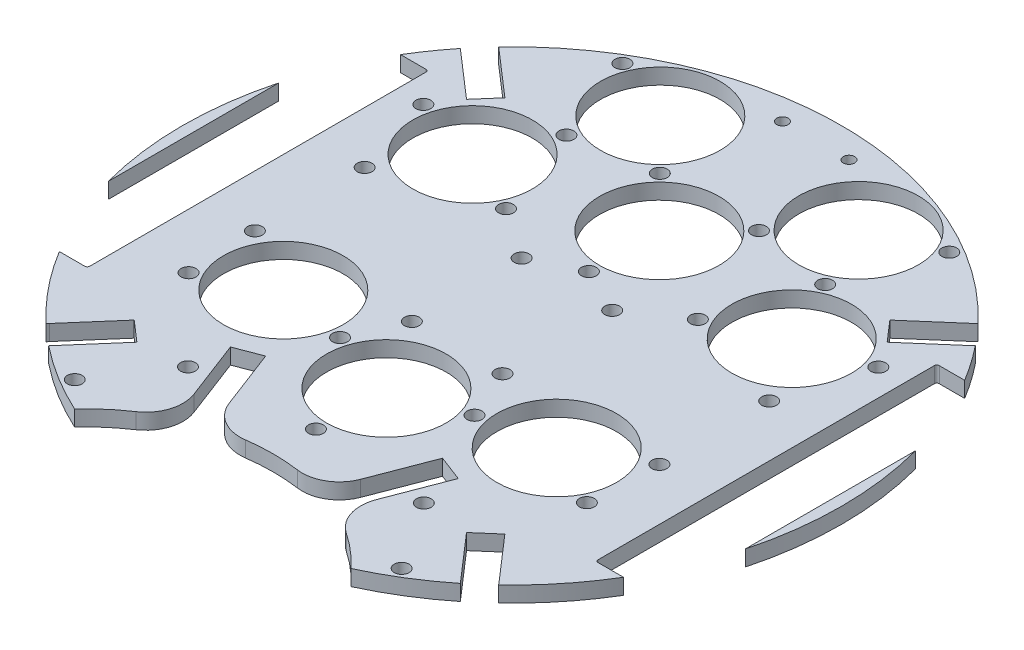
from build123d import *

# Parameters (mm, degrees)
BOSS_EXTRUDE1_OUTLINE_R   = 1.5
BOSS_EXTRUDE1_OUTLINE_R_2 = 12.095
BOSS_EXTRUDE1_OUTLINE_R_3 = 1.143
BOSS_EXTRUDE1_DEPTH       = 3.175
SKETCH2_R                 = 88.839180513
SKETCH2_R_2               = 66.67
CUT_EXTRUDE1_DEPTH        = 10


# Read off the part's stored shape, not the designer's step: Boss-Extrude1
with BuildPart() as part:
    # Boss-Extrude1 outline → Boss-Extrude1 (new body)
    with BuildSketch(Plane(origin=(0, 0, 0), x_dir=(1, 0, 0), z_dir=(0, 1, 0))):
        with BuildLine():
            Line((-45.463324447, -48.107860638), (-37.485618015, -38.930557561))
            Line((-37.485618015, -38.930557561), (-33.334715323, -42.538882221))
            Line((-33.334715323, -42.538882221), (-41.689597364, -52.150074566))
            ThreePointArc((-41.689597364, -52.150074566), (-43.455441803, -58.16401862), (-40.038526845, -63.418580622))
            ThreePointArc((-40.038526845, -63.418580622), (-37.79111892, -64.782955558), (-35.49727084, -66.067721036))
            ThreePointArc((-35.49727084, -66.067721036), (-33.357679643, -66.33740492), (-31.589980006, -65.102164912))
            ThreePointArc((-31.589980006, -65.102164912), (-26.929242455, -59.449715082), (-21.272807595, -54.79381471))
            ThreePointArc((-21.272807595, -54.79381471), (-18.309924074, -50.834725832), (-18.455489673, -45.891864903))
            Line((-18.455489673, -45.891864903), (-23.038155213, -33.91632612))
            Line((-23.038155213, -33.91632612), (-17.885625128, -31.944613407))
            Line((-17.885625128, -31.944613407), (-13.302959587, -43.920152189))
            ThreePointArc((-13.302959587, -43.920152189), (-10.111582251, -47.697475872), (-5.262593756, -48.667204744))
            ThreePointArc((-5.262593756, -48.667204744), (0, -48.302004425), (5.262593756, -48.667204744))
            ThreePointArc((5.262593756, -48.667204744), (10.111582251, -47.697475872), (13.302959587, -43.920152189))
            Line((13.302959587, -43.920152189), (17.885625128, -31.944613407))
            Line((17.885625128, -31.944613407), (23.038155213, -33.91632612))
            Line((23.038155213, -33.91632612), (18.455489673, -45.891864903))
            ThreePointArc((18.455489673, -45.891864903), (18.309924074, -50.834725832), (21.272807595, -54.79381471))
            ThreePointArc((21.272807595, -54.79381471), (26.929242455, -59.449715082), (31.589980006, -65.102164912))
            ThreePointArc((31.589980006, -65.102164912), (33.357679643, -66.33740492), (35.49727084, -66.067721036))
            ThreePointArc((35.49727084, -66.067721036), (37.79111892, -64.782955558), (40.038526845, -63.418580622))
            ThreePointArc((40.038526845, -63.418580622), (43.455441803, -58.16401862), (41.689597364, -52.150074566))
            Line((41.689597364, -52.150074566), (33.334715323, -42.538882221))
            Line((33.334715323, -42.538882221), (37.485618015, -38.930557561))
            Line((37.485618015, -38.930557561), (45.463324447, -48.107860638))
            ThreePointArc((45.463324447, -48.107860638), (51.244367279, -51.141187567), (57.212428046, -48.494722157))
            ThreePointArc((57.212428046, -48.494722157), (74.817303308, -5.231742133), (63.404808562, 40.06033264))
            ThreePointArc((63.404808562, 40.06033264), (57.863145959, 43.511637332), (51.716205935, 41.312397275))
            Line((51.716205935, 41.312397275), (42.538902858, 33.334690843))
            Line((42.538902858, 33.334690843), (38.930578931, 37.485594171))
            Line((38.930578931, 37.485594171), (48.541772751, 45.840474516))
            ThreePointArc((48.541772751, 45.840474516), (51.127412363, 51.550132777), (48.475045278, 57.229100861))
            ThreePointArc((48.475045278, 57.229100861), (0, 75), (-48.475045278, 57.229100861))
            ThreePointArc((-48.475045278, 57.229100861), (-51.127412363, 51.550132777), (-48.541772751, 45.840474516))
            Line((-48.541772751, 45.840474516), (-38.930578931, 37.485594171))
            Line((-38.930578931, 37.485594171), (-42.538902858, 33.334690843))
            Line((-42.538902858, 33.334690843), (-51.716205935, 41.312397275))
            ThreePointArc((-51.716205935, 41.312397275), (-57.863145959, 43.511637332), (-63.404808562, 40.06033264))
            ThreePointArc((-63.404808562, 40.06033264), (-74.817303308, -5.231742133), (-57.212428046, -48.494722157))
            ThreePointArc((-57.212428046, -48.494722157), (-51.244367279, -51.141187567), (-45.463324447, -48.107860638))
        make_face()
        with Locations((-33.059737365, -55.383244446)):
            Circle(BOSS_EXTRUDE1_OUTLINE_R, mode=Mode.SUBTRACT)
        with Locations((-23.852486199, -41.694616163)):
            Circle(BOSS_EXTRUDE1_OUTLINE_R, mode=Mode.SUBTRACT)
        with Locations((-40.277379234, -25.14022965)):
            Circle(BOSS_EXTRUDE1_OUTLINE_R, mode=Mode.SUBTRACT)
        with BuildLine():
            Line((-64.410067426, -34), (-64.410067426, 34))
            ThreePointArc((-64.410067426, 34), (-64.263620817, 34.353553391), (-63.910067426, 34.5))
            Line((-63.910067426, 34.5), (-51.910067426, 34.5))
            ThreePointArc((-51.910067426, 34.5), (-51.556514035, 34.353553391), (-51.410067426, 34))
            Line((-51.410067426, 34), (-51.410067426, -34))
            ThreePointArc((-51.410067426, -34), (-51.556514035, -34.353553391), (-51.910067426, -34.5))
            Line((-51.910067426, -34.5), (-63.910067426, -34.5))
            ThreePointArc((-63.910067426, -34.5), (-64.263620817, -34.353553391), (-64.410067426, -34))
        make_face(mode=Mode.SUBTRACT)
        with Locations((-40.910067426, -11.1)):
            Circle(BOSS_EXTRUDE1_OUTLINE_R, mode=Mode.SUBTRACT)
        with Locations((-27.645294552, -18.614761308)):
            Circle(BOSS_EXTRUDE1_OUTLINE_R_2, mode=Mode.SUBTRACT)
        with Locations((-13.608916499, -21.183093811)):
            Circle(BOSS_EXTRUDE1_OUTLINE_R, mode=Mode.SUBTRACT)
        with Locations((-9.160067426, -11.1)):
            Circle(BOSS_EXTRUDE1_OUTLINE_R, mode=Mode.SUBTRACT)
        with Locations((33.059737365, -55.383244446)):
            Circle(BOSS_EXTRUDE1_OUTLINE_R, mode=Mode.SUBTRACT)
        with Locations((0, -39.659190322)):
            Circle(BOSS_EXTRUDE1_OUTLINE_R, mode=Mode.SUBTRACT)
        with Locations((23.852486199, -41.694616163)):
            Circle(BOSS_EXTRUDE1_OUTLINE_R, mode=Mode.SUBTRACT)
        with Locations((0, -25.409190322)):
            Circle(BOSS_EXTRUDE1_OUTLINE_R_2, mode=Mode.SUBTRACT)
        with Locations((13.608916499, -21.183093811)):
            Circle(BOSS_EXTRUDE1_OUTLINE_R, mode=Mode.SUBTRACT)
        with Locations((27.645294552, -18.614761308)):
            Circle(BOSS_EXTRUDE1_OUTLINE_R_2, mode=Mode.SUBTRACT)
        with Locations((9.160067426, -11.1)):
            Circle(BOSS_EXTRUDE1_OUTLINE_R, mode=Mode.SUBTRACT)
        with Locations((40.277379234, -25.14022965)):
            Circle(BOSS_EXTRUDE1_OUTLINE_R, mode=Mode.SUBTRACT)
        with Locations((40.910067426, -11.1)):
            Circle(BOSS_EXTRUDE1_OUTLINE_R, mode=Mode.SUBTRACT)
        with BuildLine():
            ThreePointArc((63.910067426, 34.5), (64.263620817, 34.353553391), (64.410067426, 34))
            Line((64.410067426, 34), (64.410067426, -34))
            ThreePointArc((64.410067426, -34), (64.263620817, -34.353553391), (63.910067426, -34.5))
            Line((63.910067426, -34.5), (51.910067426, -34.5))
            ThreePointArc((51.910067426, -34.5), (51.556514035, -34.353553391), (51.410067426, -34))
            Line((51.410067426, -34), (51.410067426, 34))
            ThreePointArc((51.410067426, 34), (51.556514035, 34.353553391), (51.910067426, 34.5))
            Line((51.910067426, 34.5), (63.910067426, 34.5))
        make_face(mode=Mode.SUBTRACT)
        with Locations((-40.910067426, 11.1)):
            Circle(BOSS_EXTRUDE1_OUTLINE_R, mode=Mode.SUBTRACT)
        with Locations((-46.011477091, 28.075890486)):
            Circle(BOSS_EXTRUDE1_OUTLINE_R, mode=Mode.SUBTRACT)
        with Locations((-19.397913834, 18.186588214)):
            Circle(BOSS_EXTRUDE1_OUTLINE_R, mode=Mode.SUBTRACT)
        with Locations((-9.160067426, 11.1)):
            Circle(BOSS_EXTRUDE1_OUTLINE_R, mode=Mode.SUBTRACT)
        with Locations((-32.272094543, 24.295431891)):
            Circle(BOSS_EXTRUDE1_OUTLINE_R_2, mode=Mode.SUBTRACT)
        with Locations((-26.163250867, 37.1696126)):
            Circle(BOSS_EXTRUDE1_OUTLINE_R, mode=Mode.SUBTRACT)
        with Locations((-33.059737365, 55.383244446)):
            Circle(BOSS_EXTRUDE1_OUTLINE_R, mode=Mode.SUBTRACT)
        with Locations((-20.05440719, 50.04379331)):
            Circle(BOSS_EXTRUDE1_OUTLINE_R_2, mode=Mode.SUBTRACT)
        with Locations((-10.027203595, 39.91869143)):
            Circle(BOSS_EXTRUDE1_OUTLINE_R, mode=Mode.SUBTRACT)
        with Locations((-6.731, 61.422565207)):
            Circle(BOSS_EXTRUDE1_OUTLINE_R_3, mode=Mode.SUBTRACT)
        with Locations((9.160067426, 11.1)):
            Circle(BOSS_EXTRUDE1_OUTLINE_R, mode=Mode.SUBTRACT)
        with Locations((0, 15.543589551)):
            Circle(BOSS_EXTRUDE1_OUTLINE_R, mode=Mode.SUBTRACT)
        with Locations((19.397913834, 18.186588214)):
            Circle(BOSS_EXTRUDE1_OUTLINE_R, mode=Mode.SUBTRACT)
        with Locations((0, 29.793589551)):
            Circle(BOSS_EXTRUDE1_OUTLINE_R_2, mode=Mode.SUBTRACT)
        with Locations((32.272094543, 24.295431891)):
            Circle(BOSS_EXTRUDE1_OUTLINE_R_2, mode=Mode.SUBTRACT)
        with Locations((26.163250867, 37.1696126)):
            Circle(BOSS_EXTRUDE1_OUTLINE_R, mode=Mode.SUBTRACT)
        with Locations((40.910067426, 11.1)):
            Circle(BOSS_EXTRUDE1_OUTLINE_R, mode=Mode.SUBTRACT)
        with Locations((46.011477091, 28.075890486)):
            Circle(BOSS_EXTRUDE1_OUTLINE_R, mode=Mode.SUBTRACT)
        with Locations((10.027203595, 39.91869143)):
            Circle(BOSS_EXTRUDE1_OUTLINE_R, mode=Mode.SUBTRACT)
        with Locations((20.05440719, 50.04379331)):
            Circle(BOSS_EXTRUDE1_OUTLINE_R_2, mode=Mode.SUBTRACT)
        with Locations((33.059737365, 55.383244446)):
            Circle(BOSS_EXTRUDE1_OUTLINE_R, mode=Mode.SUBTRACT)
        with Locations((6.731, 61.422565207)):
            Circle(BOSS_EXTRUDE1_OUTLINE_R_3, mode=Mode.SUBTRACT)
    extrude(amount=BOSS_EXTRUDE1_DEPTH)

    # Sketch2 → Cut-Extrude1 (cut)
    with BuildSketch(Plane(origin=(0, 3.175, 0), x_dir=(1, 0, 0), z_dir=(0, 1, 0))):
        Circle(SKETCH2_R)
        Circle(SKETCH2_R_2, mode=Mode.SUBTRACT)
    extrude(amount=-CUT_EXTRUDE1_DEPTH, mode=Mode.SUBTRACT)


with BuildPart() as cut_extrude1_piece_1:
    # of the separate pieces the step leaves, piece 1, a body of its own (cut_extrude1_pieces)
    add(part.part.solids().sort_by_distance((-45.761517323, 0, 48.484764951))[0])


with BuildPart() as cut_extrude1_piece_2:
    # of the separate pieces the step leaves, piece 2, a body of its own (cut_extrude1_pieces)
    add(part.part.solids().sort_by_distance((64.410067426, 0, -17.211394893))[0])


with BuildPart() as cut_extrude1_piece_3:
    # of the separate pieces the step leaves, piece 3, a body of its own (cut_extrude1_pieces)
    add(part.part.solids().sort_by_distance((-64.410067426, 0, -17.211394893))[0])


solid = Compound([cut_extrude1_piece_1.part, cut_extrude1_piece_2.part, cut_extrude1_piece_3.part])
